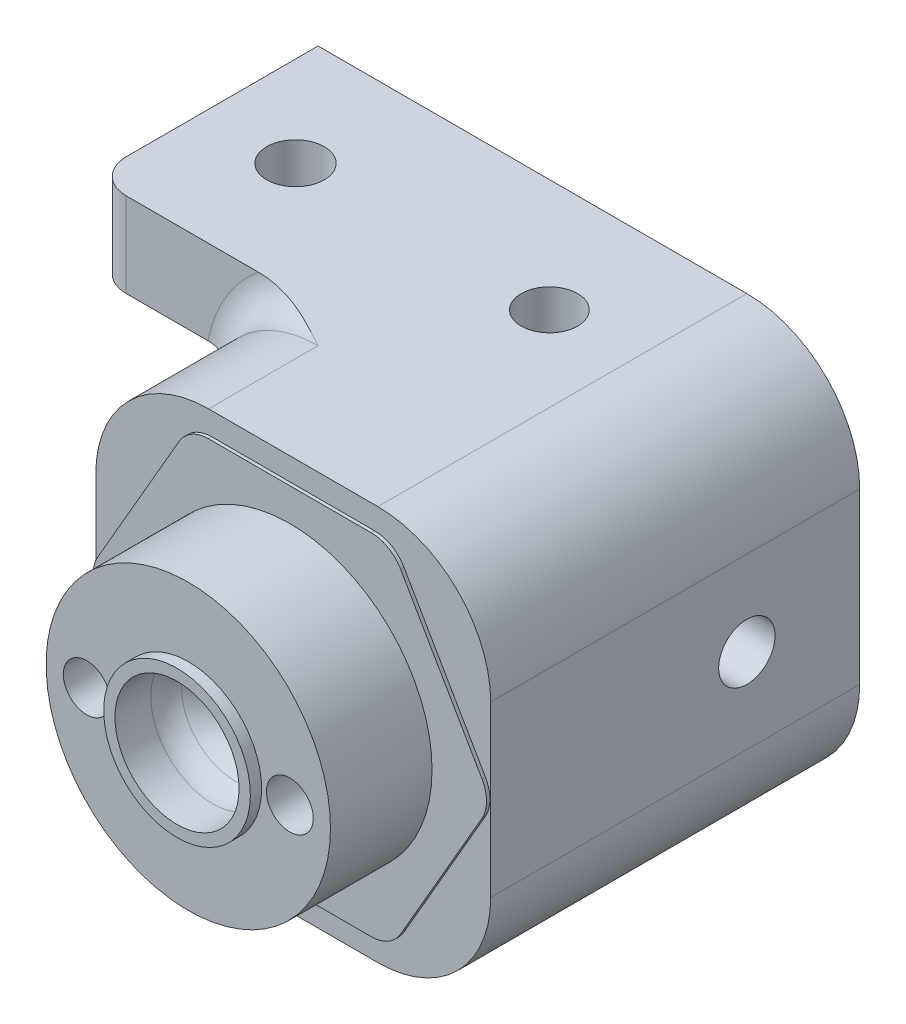
from build123d import *

# Parameters (mm, degrees)
SKETCH_1_R               = 12.6
EXTRUDE_1_DEPTH          = 9
SKETCH_2_R               = 15
EXTRUDE_2_DEPTH          = 5
SKETCH_3_R               = 5.5
CUT_EXTRUDE_1_DEPTH      = 5
SKETCH_4_R               = 2.075
CUT_EXTRUDE_2_DEPTH      = 29
SKETCH_5_R               = 3.5
CUT_EXTRUDE_3_DEPTH      = 31
FILLET_1_R               = 3
FILLET_2_R               = 5
EXTRUDE_START            = 1
SKETCH_6_R               = 6.5
SKETCH_6_R_2             = 5.5
EXTRUDE_1_2_DEPTH        = 1
EXTRUDE_START_2          = -5
SKETCH_7_R               = 15
EXTRUDE_3_DEPTH          = 5
FILLET_3_R               = 3
EXTRUDE_START_3          = 8
SKETCH_8_R               = 3.5
SKETCH_8_R_2             = 4
EXTRUDE_4_DEPTH          = 8
SKETCH_9_W               = 35
SKETCH_9_H               = 35
SKETCH_9_W_2             = 20
SKETCH_9_H_2             = 20
EXTRUDE_5_DEPTH          = 20
SKETCH_10_W              = 35
SKETCH_10_H              = 35
EXTRUDE_6_DEPTH          = 8.5
FILLET_4_R               = 10
SKETCH_11_R              = 2.5
CUT_EXTRUDE_4_DEPTH      = 15
PATTERN_CIRCULAR_1_COUNT = 4
CUT_EXTRUDE_START        = 83
SKETCH_12_R              = 4
CUT_EXTRUDE_5_DEPTH      = 83
SKETCH_14_W              = 23.212780374
SKETCH_14_H              = 20
CUT_EXTRUDE_6_DEPTH      = 41
EXTRUDE_7_DEPTH          = 1.3
SKETCH_16_W              = 9.986830102
SKETCH_16_H              = 7
CUT_EXTRUDE_7_DEPTH      = 3
SKETCH_18_W              = 23
SKETCH_18_H              = 7.5
EXTRUDE_8_DEPTH          = 20
SKETCH_19_R              = 2.55
CUT_EXTRUDE_8_DEPTH      = 20
FILLET_8_R               = 3
FILLET_9_R               = 3
EXTRUDE_9_DEPTH          = 2.9


with BuildPart() as part:
    # 草图1 → Extrude 1 (new body)
    with BuildSketch(Plane.XY):
        Circle(SKETCH_1_R)
    extrude(amount=EXTRUDE_1_DEPTH)

    # 草图2 → 凸台-拉伸2 (add)
    with BuildSketch(Plane(origin=(0, 0, 0), x_dir=(-1, 0, 0), z_dir=(0, 0, -1))):
        Circle(SKETCH_2_R)
    extrude(amount=EXTRUDE_2_DEPTH)

    # 草图3 → Cut-Extrude 1 (cut)
    with BuildSketch(Plane.XY.offset(9)):
        Circle(SKETCH_3_R)
    extrude(amount=-CUT_EXTRUDE_1_DEPTH, mode=Mode.SUBTRACT)

    # 草图4 → 切除-拉伸2 (cut)
    with BuildSketch(Plane.XY.offset(9)):
        with Locations((-9, 0)):
            Circle(SKETCH_4_R)
        with Locations((9, 0)):
            Circle(SKETCH_4_R)
    extrude(amount=-CUT_EXTRUDE_2_DEPTH, mode=Mode.SUBTRACT)

    # 草图5 → 切除-拉伸3 (cut)
    with BuildSketch(Plane.XY.offset(4)):
        Circle(SKETCH_5_R)
    extrude(amount=-CUT_EXTRUDE_3_DEPTH, mode=Mode.SUBTRACT)

    # 圆角1
    # the kernel refuses this fillet: 3 mm, written as the material it adds along each edge
    with BuildSketch(Plane(origin=(0, 0, 4), x_dir=(1, 0, 0), z_dir=(0, -1, 0))) as fillet_1_piece_1:
        with BuildLine():
            CenterArc((2.5, 2.828427125), FILLET_1_R, 289.471220634, 70.528779366)
            Line((5.5, 2.828427125), (5.56, 2.828427125))
            Line((5.56, 2.828427125), (5.56, 0))
            Line((5.56, 0), (5.5, -0.06))
            ThreePointArc((5.5, -0.06), (4.5, -0.06), (3.52, -0.056568542))
            Line((3.52, -0.056568542), (3.5, 0))
        make_face()
    revolve(axis=Axis((0, 0, 4), (0, 0, 1)))

    # 圆角2
    fillet_2_edges = [part.edges().sort_by_distance(p)[0] for p in [
        (-3.5, 0, 4),
    ]]
    fillet(fillet_2_edges, radius=FILLET_2_R)

    # 草图6 → Extrude 1 2 (add)
    with BuildSketch(Plane.XY.offset(9).offset(EXTRUDE_START)):
        Circle(SKETCH_6_R)
        Circle(SKETCH_6_R_2, mode=Mode.SUBTRACT)
    extrude(amount=-EXTRUDE_1_2_DEPTH)

    # 草图7 → 凸台-拉伸3 (add)
    with BuildSketch(Plane(origin=(0, 0, -5), x_dir=(-1, 0, 0), z_dir=(0, 0, -1)).offset(EXTRUDE_START_2)):
        Polygon((-8.948929172, 15.5), (-17.897858345, 0), (-8.948929172, -15.5), (8.948929172, -15.5), (17.897858345, 0), (8.948929172, 15.5), align=None)
        Circle(SKETCH_7_R, mode=Mode.SUBTRACT)
    extrude(amount=EXTRUDE_3_DEPTH)

    # 圆角3
    fillet_3_edges = [part.edges().sort_by_distance(p)[0] for p in [
        (17.897858345, 0, -2.5),
        (8.948929172, -15.5, -2.5),
        (-8.948929172, -15.5, -2.5),
        (-17.897858345, 0, -2.5),
        (-8.948929172, 15.5, -2.5),
        (8.948929172, 15.5, -2.5),
    ]]
    fillet(fillet_3_edges, radius=FILLET_3_R)

    # 草图8 → 凸台-拉伸4 (add)
    with BuildSketch(Plane(origin=(0, 0, -5), x_dir=(-1, 0, 0), z_dir=(0, 0, -1)).offset(EXTRUDE_START_3)):
        with BuildLine():
            Line((-9.814954576, 14), (-17.031832941, 1.5))
            ThreePointArc((-17.031832941, 1.5), (-17.43375673, 0), (-17.031832941, -1.5))
            Line((-17.031832941, -1.5), (-9.814954576, -14))
            ThreePointArc((-9.814954576, -14), (-8.716878365, -15.098076211), (-7.216878365, -15.5))
            Line((-7.216878365, -15.5), (7.216878365, -15.5))
            ThreePointArc((7.216878365, -15.5), (8.716878365, -15.098076211), (9.814954576, -14))
            Line((9.814954576, -14), (17.031832941, -1.5))
            ThreePointArc((17.031832941, -1.5), (17.43375673, 0), (17.031832941, 1.5))
            Line((17.031832941, 1.5), (9.814954576, 14))
            ThreePointArc((9.814954576, 14), (8.716878365, 15.098076211), (7.216878365, 15.5))
            Line((7.216878365, 15.5), (-7.216878365, 15.5))
            ThreePointArc((-7.216878365, 15.5), (-8.716878365, 15.098076211), (-9.814954576, 14))
        make_face()
        Circle(SKETCH_8_R, mode=Mode.SUBTRACT)
        with Locations((-9, 0)):
            Circle(SKETCH_8_R_2, mode=Mode.SUBTRACT)
        with Locations((9, 0)):
            Circle(SKETCH_8_R_2, mode=Mode.SUBTRACT)
    extrude(amount=-EXTRUDE_4_DEPTH)

    # 草图9 → 凸台-拉伸5 (add)
    with BuildSketch(Plane(origin=(0, 0, -13), x_dir=(-1, 0, 0), z_dir=(0, 0, -1))):
        Rectangle(SKETCH_9_W, SKETCH_9_H)
        Rectangle(SKETCH_9_W_2, SKETCH_9_H_2, mode=Mode.SUBTRACT)
    extrude(amount=EXTRUDE_5_DEPTH)

    # 草图10 → 凸台-拉伸6 (add)
    with BuildSketch(Plane.XY.offset(-13)):
        Rectangle(SKETCH_10_W, SKETCH_10_H)
        with BuildLine():
            Line((7.216878365, 15.5), (-7.216878365, 15.5))
            ThreePointArc((-7.216878365, 15.5), (-8.716878365, 15.098076211), (-9.814954576, 14))
            Line((-9.814954576, 14), (-17.031832941, 1.5))
            ThreePointArc((-17.031832941, 1.5), (-17.43375673, 0), (-17.031832941, -1.5))
            Line((-17.031832941, -1.5), (-9.814954576, -14))
            ThreePointArc((-9.814954576, -14), (-8.716878365, -15.098076211), (-7.216878365, -15.5))
            Line((-7.216878365, -15.5), (7.216878365, -15.5))
            ThreePointArc((7.216878365, -15.5), (8.716878365, -15.098076211), (9.814954576, -14))
            Line((9.814954576, -14), (17.031832941, -1.5))
            ThreePointArc((17.031832941, -1.5), (17.43375673, 0), (17.031832941, 1.5))
            Line((17.031832941, 1.5), (9.814954576, 14))
            ThreePointArc((9.814954576, 14), (8.716878365, 15.098076211), (7.216878365, 15.5))
        make_face(mode=Mode.SUBTRACT)
    extrude(amount=EXTRUDE_6_DEPTH)

    # 圆角4
    fillet_4_edges = [part.edges().sort_by_distance(p)[0] for p in [
        (17.5, 17.5, -18.75),
        (17.5, -17.5, -18.75),
        (-17.5, -17.5, -18.75),
        (-17.5, 17.5, -18.75),
    ]]
    fillet(fillet_4_edges, radius=FILLET_4_R)

    # 草图11 → 切除-拉伸4 (cut)
    with BuildSketch(Plane.ZY.offset(17.5)):
        with Locations(Location((-23, 0, 0), (0, 0, 270))):
            Circle(SKETCH_11_R)
    cut_extrude_4 = extrude(amount=-CUT_EXTRUDE_4_DEPTH, mode=Mode.SUBTRACT)

    # 阵列(圆周)1: 切除-拉伸4 ×4 about axis
    pattern_circular_1_axis = Axis((0, 0, -27), (0, 0, 1))
    for i in range(1, PATTERN_CIRCULAR_1_COUNT):
        add(cut_extrude_4.rotate(pattern_circular_1_axis, i * 360 / PATTERN_CIRCULAR_1_COUNT), mode=Mode.SUBTRACT)

    # 草图12 → 切除-拉伸5 (cut)
    with BuildSketch(Plane(origin=(0, 0, -5), x_dir=(-1, 0, 0), z_dir=(0, 0, -1)).offset(CUT_EXTRUDE_START)):
        with Locations(Location((9, 0, 0), (0, 0, 75.522487814))):
            Circle(SKETCH_12_R)
        with Locations(Location((-9, 0, 0), (0, 0, 255.522487814))):
            Circle(SKETCH_12_R)
    extrude(amount=-CUT_EXTRUDE_5_DEPTH, mode=Mode.SUBTRACT)

    # 草图14 → 切除-拉伸6 (cut)
    with BuildSketch(Plane(origin=(0, 0, -13), x_dir=(-1, 0, 0), z_dir=(0, 0, -1))):
        with Locations((21.606390187, 0)):
            Rectangle(SKETCH_14_W, SKETCH_14_H)
    extrude(amount=CUT_EXTRUDE_6_DEPTH, mode=Mode.SUBTRACT)

    # 草图15 → 凸台-拉伸7 (add)
    with BuildSketch(Plane.XY.offset(-4.5)):
        with BuildLine():
            Line((7.5, 17.5), (-7.5, 17.5))
            ThreePointArc((-7.5, 17.5), (-14.571067812, 14.571067812), (-17.5, 7.5))
            Line((-17.5, 7.5), (-17.5, -7.5))
            ThreePointArc((-17.5, -7.5), (-14.571067812, -14.571067812), (-7.5, -17.5))
            Line((-7.5, -17.5), (7.5, -17.5))
            ThreePointArc((7.5, -17.5), (14.571067812, -14.571067812), (17.5, -7.5))
            Line((17.5, -7.5), (17.5, 7.5))
            ThreePointArc((17.5, 7.5), (14.571067812, 14.571067812), (7.5, 17.5))
        make_face()
        with BuildLine():
            Line((9.814954576, -14), (17.031832941, -1.5))
            ThreePointArc((17.031832941, -1.5), (17.43375673, 0), (17.031832941, 1.5))
            Line((17.031832941, 1.5), (9.814954576, 14))
            ThreePointArc((9.814954576, 14), (8.716878365, 15.098076211), (7.216878365, 15.5))
            Line((7.216878365, 15.5), (-7.216878365, 15.5))
            ThreePointArc((-7.216878365, 15.5), (-8.716878365, 15.098076211), (-9.814954576, 14))
            Line((-9.814954576, 14), (-17.031832941, 1.5))
            ThreePointArc((-17.031832941, 1.5), (-17.43375673, 0), (-17.031832941, -1.5))
            Line((-17.031832941, -1.5), (-9.814954576, -14))
            ThreePointArc((-9.814954576, -14), (-8.716878365, -15.098076211), (-7.216878365, -15.5))
            Line((-7.216878365, -15.5), (7.216878365, -15.5))
            ThreePointArc((7.216878365, -15.5), (8.716878365, -15.098076211), (9.814954576, -14))
        make_face(mode=Mode.SUBTRACT)
    extrude(amount=EXTRUDE_7_DEPTH)

    # 草图16 → 切除-拉伸7 (cut)
    with BuildSketch(Plane(origin=(0, 0, -13), x_dir=(-1, 0, 0), z_dir=(0, 0, -1))):
        with Locations((-4.993415051, 0)):
            Rectangle(SKETCH_16_W, SKETCH_16_H)
    extrude(amount=-CUT_EXTRUDE_7_DEPTH, mode=Mode.SUBTRACT)

    # 草图18 → 凸台-拉伸8 (add)
    with BuildSketch(Plane(origin=(0, 0, -13), x_dir=(-1, 0, 0), z_dir=(0, 0, -1))):
        with Locations((19, 13.75)):
            Rectangle(SKETCH_18_W, SKETCH_18_H)
    extrude_8 = extrude(amount=EXTRUDE_8_DEPTH)

    # 草图19 → 切除-拉伸8 (cut)
    with BuildSketch(Plane(origin=(0, 17.5, 0), x_dir=(1, 0, 0), z_dir=(0, 1, 0))):
        with Locations(Location((-22.5, 23, 0), (0, 0, 180))):
            Circle(SKETCH_19_R)
    cut_extrude_8 = extrude(amount=-CUT_EXTRUDE_8_DEPTH, mode=Mode.SUBTRACT)

    # 镜向1: 凸台-拉伸8, 切除-拉伸8 across plane
    add(extrude_8.mirror(Plane.ZX))
    add(cut_extrude_8.mirror(Plane.ZX), mode=Mode.SUBTRACT)

    # 圆角8
    # the kernel refuses this fillet: 3 mm, written as the material it adds along each edge
    with BuildSketch(Plane(origin=(-7.5, 7.5, -13), x_dir=(0.6817939582921204, 0.7315442559656677, 0), z_dir=(0.7315442559656677, -0.6817939582921204, 0))) as fillet_8_piece_1_section:
        with BuildLine():
            CenterArc((10 + FILLET_8_R, FILLET_8_R), FILLET_8_R, 180, 90)
            Line((10, FILLET_8_R), (10, 0))
            Line((10, 0), (10 + FILLET_8_R, 0))
        make_face()
    fillet_8_piece_1 = revolve(axis=Axis((-7.5, 7.5, -13), (0, 0, 1)), revolution_arc=161.490465461, mode=Mode.PRIVATE)
    fillet_8_piece_1 = split(fillet_8_piece_1, bisect_by=Plane(origin=(-14.518222351, 17.5, -12.247981019), z_dir=(0, -1, 0)), keep=Keep.TOP, mode=Mode.PRIVATE)
    fillet_8_piece_1 = split(fillet_8_piece_1, bisect_by=Plane(origin=(-14.518222351, 10, -12.247981019), z_dir=(0, 1, 0)), keep=Keep.TOP, mode=Mode.PRIVATE)
    add(fillet_8_piece_1)
    with BuildSketch(Plane(origin=(-7.5, -7.5, -13), x_dir=(0.681793958292121, -0.7315442559656672, 0), z_dir=(0.7315442559656672, 0.681793958292121, 0))) as fillet_8_piece_2_section:
        with BuildLine():
            CenterArc((10 + FILLET_8_R, -FILLET_8_R), FILLET_8_R, 90, 90)
            Line((10, -FILLET_8_R), (10, 0))
            Line((10, 0), (10 + FILLET_8_R, 0))
        make_face()
    fillet_8_piece_2 = revolve(axis=Axis((-7.5, -7.5, -13), (0, 0, -1)), revolution_arc=161.490465461, mode=Mode.PRIVATE)
    fillet_8_piece_2 = split(fillet_8_piece_2, bisect_by=Plane(origin=(-14.518221596, -10, -12.247980438), z_dir=(0, -1, 0)), keep=Keep.TOP, mode=Mode.PRIVATE)
    fillet_8_piece_2 = split(fillet_8_piece_2, bisect_by=Plane(origin=(-14.518221596, -17.5, -12.247980438), z_dir=(0, 1, 0)), keep=Keep.TOP, mode=Mode.PRIVATE)
    add(fillet_8_piece_2)

    # 圆角9
    fillet_9_edges = [part.edges().sort_by_distance(p)[0] for p in [
        (-30.5, 13.75, -13),
        (-30.5, -13.75, -13),
    ]]
    fillet(fillet_9_edges, radius=FILLET_9_R)

    # 草图20 → 凸台-拉伸9 (add)
    with BuildSketch(Plane.XY.offset(-3.2)):
        with BuildLine():
            Line((7.5, 17.5), (-7.5, 17.5))
            ThreePointArc((-7.5, 17.5), (-14.571067812, 14.571067812), (-17.5, 7.5))
            Line((-17.5, 7.5), (-17.5, -7.5))
            ThreePointArc((-17.5, -7.5), (-14.571067812, -14.571067812), (-7.5, -17.5))
            Line((-7.5, -17.5), (7.5, -17.5))
            ThreePointArc((7.5, -17.5), (14.571067812, -14.571067812), (17.5, -7.5))
            Line((17.5, -7.5), (17.5, 7.5))
            ThreePointArc((17.5, 7.5), (14.571067812, 14.571067812), (7.5, 17.5))
        make_face()
        with BuildLine():
            Line((9.814954576, -14), (17.031832941, -1.5))
            ThreePointArc((17.031832941, -1.5), (17.43375673, 0), (17.031832941, 1.5))
            Line((17.031832941, 1.5), (9.814954576, 14))
            ThreePointArc((9.814954576, 14), (8.716878365, 15.098076211), (7.216878365, 15.5))
            Line((7.216878365, 15.5), (-7.216878365, 15.5))
            ThreePointArc((-7.216878365, 15.5), (-8.716878365, 15.098076211), (-9.814954576, 14))
            Line((-9.814954576, 14), (-17.031832941, 1.5))
            ThreePointArc((-17.031832941, 1.5), (-17.43375673, 0), (-17.031832941, -1.5))
            Line((-17.031832941, -1.5), (-9.814954576, -14))
            ThreePointArc((-9.814954576, -14), (-8.716878365, -15.098076211), (-7.216878365, -15.5))
            Line((-7.216878365, -15.5), (7.216878365, -15.5))
            ThreePointArc((7.216878365, -15.5), (8.716878365, -15.098076211), (9.814954576, -14))
        make_face(mode=Mode.SUBTRACT)
    extrude(amount=EXTRUDE_9_DEPTH)


solid = part.part
